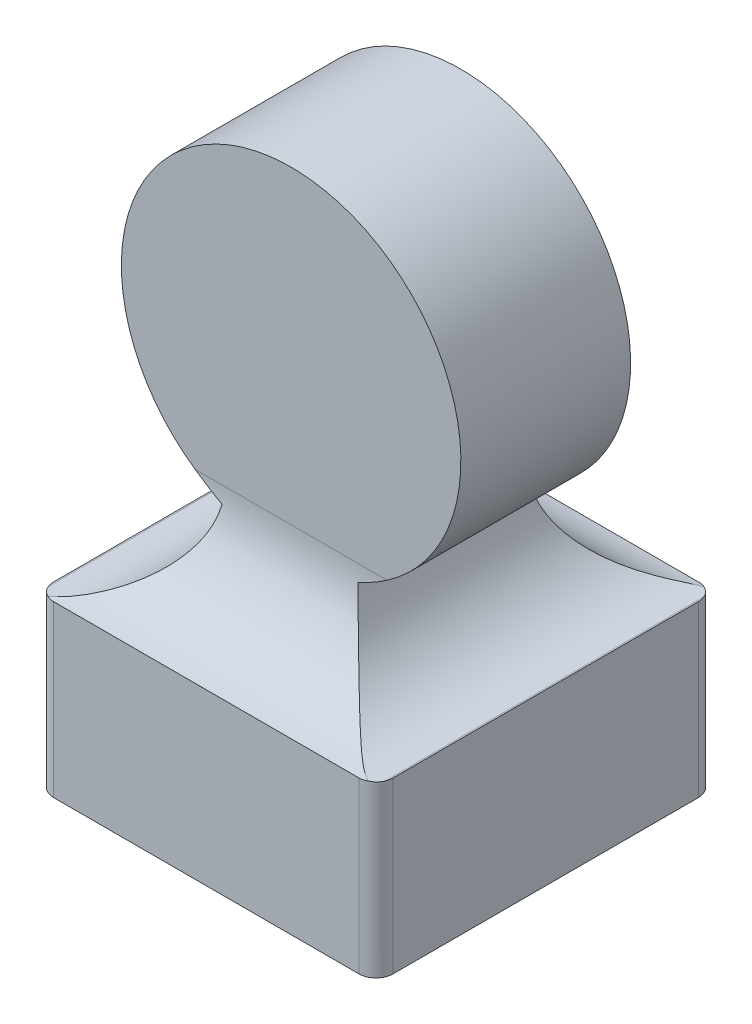
from build123d import *
from OCP.BRepAlgoAPI import BRepAlgoAPI_Cut
from OCP.TopTools import TopTools_ListOfShape

# Parameters (mm, degrees)
SKIZZE1_W                       = 20
SKIZZE1_H                       = 20
AUFSATZ_LINEAR_AUSTRAGEN1_DEPTH = 10
AUFSATZ_LINEAR_AUSTRAGEN2_DEPTH = 5
VERRUNDUNG1_START               = -5
VERRUNDUNG1_DEPTH               = 10
VERRUNDUNG1_START_2             = -10.000001186
VERRUNDUNG1_2_DEPTH             = 20.000001186
VERRUNDUNG1_START_3             = -11
VERRUNDUNG1_3_DEPTH             = 22
VERRUNDUNG2_R                   = 1


with BuildPart() as part:
    # Skizze1 → Aufsatz-Linear austragen1 (new body)
    with BuildSketch(Plane(origin=(0, 0, 0), x_dir=(1, 0, 0), z_dir=(0, 1, 0))):
        Rectangle(SKIZZE1_W, SKIZZE1_H)
    extrude(amount=AUFSATZ_LINEAR_AUSTRAGEN1_DEPTH)

    # Skizze3 → Aufsatz-Linear austragen2 (add, symmetric)
    with BuildSketch(Plane.XY):
        with BuildLine():
            Line((-4, 15), (-4, 10))
            Line((-4, 10), (4, 10))
            Line((4, 10), (4, 15))
            ThreePointArc((4, 15), (0, 34.16515139), (-4, 15))
        make_face()
    extrude(amount=AUFSATZ_LINEAR_AUSTRAGEN2_DEPTH, both=True)


with BuildPart() as verrundung1_tool:
    # Verrundung1: read off the stored shape, not the designer's step
    # Verrundung1 outline → Verrundung1 (new body)
    with BuildSketch(Plane.XY.offset(VERRUNDUNG1_START)):
        with BuildLine():
            Line((4, 10), (9.916079783, 10))
            ThreePointArc((9.916079783, 10), (6.043096437, 11.417424305), (4, 15))
            Line((4, 15), (4, 10))
        make_face()
        with BuildLine():
            Line((-9.916079783, 10), (-4, 10))
            Line((-4, 10), (-4, 15))
            ThreePointArc((-4, 15), (-6.043096437, 11.417424305), (-9.916079783, 10))
        make_face()
    extrude(amount=VERRUNDUNG1_DEPTH)


with BuildPart() as part_1:
    add(part.part)


with BuildPart() as part_2:
    # Verrundung1: joined with verrundung1_tool
    add(part_1.part.fuse(verrundung1_tool.part, tol=0.00001))


with BuildPart() as verrundung1_2_tool:
    # Verrundung1 2 outline → Verrundung1 2 (new body)
    with BuildSketch(Plane.XY.offset(VERRUNDUNG1_START_2)):
        with BuildLine():
            Line((-9.916079783, 10), (9.916079783, 10))
            ThreePointArc((9.916079783, 10), (6.043096437, 11.417424305), (4, 15))
            ThreePointArc((4, 15), (0, 34.16515139), (-4, 15))
            ThreePointArc((-4, 15), (-6.043096437, 11.417424305), (-9.916079783, 10))
        make_face()
    extrude(amount=VERRUNDUNG1_2_DEPTH)


with BuildPart() as part_3:
    add(part_2.part)


with BuildPart() as part_4:
    # Verrundung1 2: joined with verrundung1_2_tool
    add(part_3.part.fuse(verrundung1_2_tool.part, tol=0.00001))


with BuildPart() as verrundung1_3_tool:
    # Verrundung1 3 outline → Verrundung1 3 (new body)
    with BuildSketch(Plane.YZ.offset(VERRUNDUNG1_START_3)):
        with BuildLine():
            Line((15.916079783, 5), (34.16515139, 5))
            Line((34.16515139, 5), (36, 5))
            Line((36, 5), (36, 10))
            Line((36, 10), (34.16515139, 10))
            Line((34.16515139, 10), (9.999989402, 10.000062699))
            ThreePointArc((9.999989402, 10.000062699), (12.043072154, 6.417444828), (15.916079783, 5))
        make_face()
        with BuildLine():
            Line((36, -10.000001186), (36, -5))
            Line((36, -5), (34.16515139, -5))
            Line((34.16515139, -5), (15.916079783, -5))
            ThreePointArc((15.916079783, -5), (12.043072154, -6.417444828), (9.999989402, -10.000062699))
            Line((9.999989402, -10.000062699), (34.16515139, -10.000001186))
            Line((34.16515139, -10.000001186), (36, -10.000001186))
        make_face()
    extrude(amount=VERRUNDUNG1_3_DEPTH)


with BuildPart() as part_5:
    add(part_4.part)

    # Verrundung1 3: cut by verrundung1_3_tool, with a tolerance
    verrundung1_3_stock = TopTools_ListOfShape()
    verrundung1_3_stock.Append(part_5.part.wrapped)
    verrundung1_3_tools = TopTools_ListOfShape()
    verrundung1_3_tools.Append(verrundung1_3_tool.part.wrapped)
    verrundung1_3_cut = BRepAlgoAPI_Cut()
    verrundung1_3_cut.SetArguments(verrundung1_3_stock)
    verrundung1_3_cut.SetTools(verrundung1_3_tools)
    verrundung1_3_cut.SetFuzzyValue(0.00001)
    verrundung1_3_cut.Build()
    add(Compound.cast(verrundung1_3_cut.Shape()).solids(), mode=Mode.REPLACE)

    # Verrundung2
    # the kernel refuses this fillet: 1 mm, written as the material it takes off along each edge
    with BuildSketch(Plane(origin=(-10, -2.5, 10), x_dir=(1, 0, 0), z_dir=(0, 1, 0)), Plane(origin=(-10, -2.5, -10), x_dir=(0, 0, 1), z_dir=(0, 1, 0))) as verrundung2_piece_1:
        with BuildLine():
            CenterArc((VERRUNDUNG2_R, VERRUNDUNG2_R), VERRUNDUNG2_R, 180, 90)
            Line((0, VERRUNDUNG2_R), (0, 0))
            Line((0, 0), (VERRUNDUNG2_R, 0))
        make_face()
    extrude(amount=15, mode=Mode.SUBTRACT)
    with BuildSketch(Plane(origin=(10, -2.5, -10), x_dir=(0, 0, 1), z_dir=(0, 1, 0)), Plane(origin=(10, -2.5, 10), x_dir=(-1, 0, 0), z_dir=(0, 1, 0))) as verrundung2_piece_2:
        with BuildLine():
            CenterArc((VERRUNDUNG2_R, -VERRUNDUNG2_R), VERRUNDUNG2_R, 90, 90)
            Line((0, -VERRUNDUNG2_R), (0, 0))
            Line((0, 0), (VERRUNDUNG2_R, 0))
        make_face()
    extrude(amount=15, mode=Mode.SUBTRACT)


solid = part_5.part
